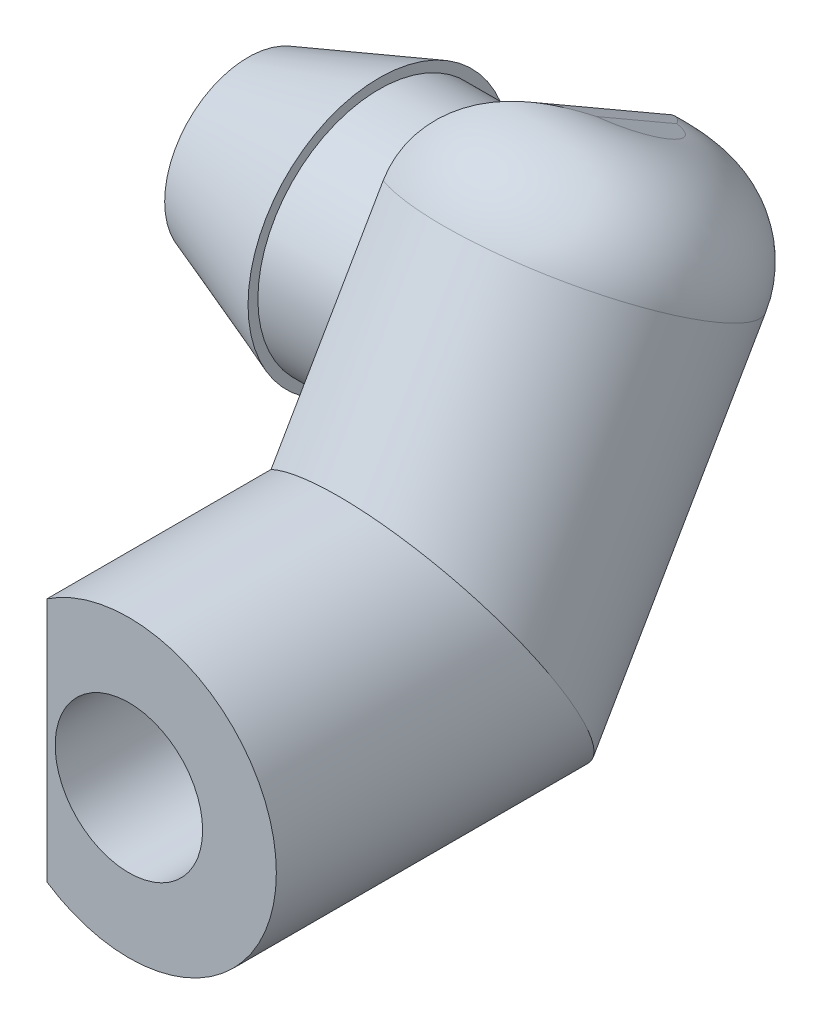
from build123d import *

# Parameters (mm, degrees)
FILLET1_R                       = 1.5
SKETCH3_R                       = 1.125
CUT_EXTRUDE1_DEPTH              = 5.7
SKETCH4_R                       = 1.85
BOSS_EXTRUDE1_DEPTH             = 1.2
BOSS_EXTRUDE1_DIRECTION_2_REACH = 13.17
SKETCH5_R                       = 2
BOSS_EXTRUDE2_DEPTH             = 2
BOSS_EXTRUDE2_TAPER             = 20
SKETCH8_R                       = 0.85
CUT_EXTRUDE2_DEPTH              = 2.4
SKETCH7_W                       = 2
SKETCH7_H                       = 0.7
CUT_EXTRUDE5_DEPTH              = 1.7


with BuildPart() as part:
    # Sweep1: sweep along a path in Sketch2
    with BuildLine(Plane(origin=(0, 0, 0), x_dir=(0, 0, -1), z_dir=(1, 0, 0))) as sweep1_path:
        Line((0, 0), (4.5, 0))
        Line((4.5, 0), (7.5, 5.196152423))
    # Sketch1 → Sweep1 (sweep)
    with BuildSketch(Plane.XY):
        with BuildLine():
            Line((-1.25, 1.870828693), (-1.25, -1.870828693))
            ThreePointArc((-1.25, -1.870828693), (2.25, 0), (-1.25, 1.870828693))
        make_face()
    sweep(path=sweep1_path.line, transition=Transition.RIGHT)

    # Fillet1
    # the kernel refuses this fillet: 1.5 mm, written as the material it takes off along each edge
    with BuildSketch(Plane(origin=(0, 5.196152423, -7.5), x_dir=(-0.9999950652018581, 0.0015707937429397924, 0.0027206945709829077), z_dir=(-0.003141587485879499, -0.4999975326009265, -0.8660211301238867))) as fillet1_piece_1:
        with BuildLine():
            CenterArc((2.25 - FILLET1_R, -FILLET1_R), FILLET1_R, 360, 90)
            Line((2.25 - FILLET1_R, 0), (2.25, 0))
            Line((2.25, 0), (2.25, -FILLET1_R))
        make_face()
    revolve(axis=Axis((0, 5.196152423, -7.5), (0, 0.8660254037844402, -0.49999999999999745)), revolution_arc=359.64, mode=Mode.SUBTRACT)
    with BuildSketch(Plane(origin=(-1.25, 8.006566769, -2.632219561), x_dir=(0, -0.8660254037844399, 0.49999999999999756), z_dir=(0, -0.4999999999999976, -0.86602540378444))) as fillet1_piece_2:
        with BuildLine():
            CenterArc((FILLET1_R, -FILLET1_R), FILLET1_R, 90, 90)
            Line((0, -FILLET1_R), (0, 0))
            Line((0, 0), (FILLET1_R, 0))
        make_face()
    extrude(amount=11.241657387, mode=Mode.SUBTRACT)

    # Sketch3 → Cut-Extrude1 (cut)
    with BuildSketch(Plane.XY):
        Circle(SKETCH3_R)
    extrude(amount=-CUT_EXTRUDE1_DEPTH, mode=Mode.SUBTRACT)

    # Sketch4 → Boss-Extrude1 (add)
    with BuildSketch(Plane.ZY.offset(1.25)):
        with Locations((-6.268038178, 3.020674567)):
            Circle(SKETCH4_R)
    extrude(amount=BOSS_EXTRUDE1_DEPTH)

    # Sketch4 → Boss-Extrude1 direction 2 (add, up to next)
    with BuildSketch(Plane.ZY.offset(1.25), mode=Mode.PRIVATE) as boss_extrude1_direction_2_sk1:
        with Locations((-6.268038178, 3.020674567)):
            Circle(SKETCH4_R)
    boss_extrude1_direction_2_tool1 = extrude(boss_extrude1_direction_2_sk1.sketch, amount=-BOSS_EXTRUDE1_DIRECTION_2_REACH, mode=Mode.PRIVATE) - part.part
    add(boss_extrude1_direction_2_tool1.solids().sort_by_distance((-1.25, 3.020675, -6.268038))[0])

    # Sketch5 → Boss-Extrude2 (add)
    with BuildSketch(Plane.ZY.offset(2.45)):
        with Locations((-6.268038178, 3.020674567)):
            Circle(SKETCH5_R)
    extrude(amount=BOSS_EXTRUDE2_DEPTH, taper=BOSS_EXTRUDE2_TAPER)

    # Sketch8 → Cut-Extrude2 (cut)
    with BuildSketch(Plane.ZY.offset(4.45)):
        with Locations((-6.268038178, 3.020674567)):
            Circle(SKETCH8_R)
    extrude(amount=-CUT_EXTRUDE2_DEPTH, mode=Mode.SUBTRACT)

    # Sketch7 → Cut-Extrude5 (cut, symmetric)
    with BuildSketch(Plane(origin=(0, 0, -8.118038178), x_dir=(-1, 0, 0), z_dir=(0, 0, -1))):
        with Locations((3.45, 3.020674567)):
            Rectangle(SKETCH7_W, SKETCH7_H)
    extrude(amount=CUT_EXTRUDE5_DEPTH, both=True, mode=Mode.SUBTRACT)


solid = part.part
